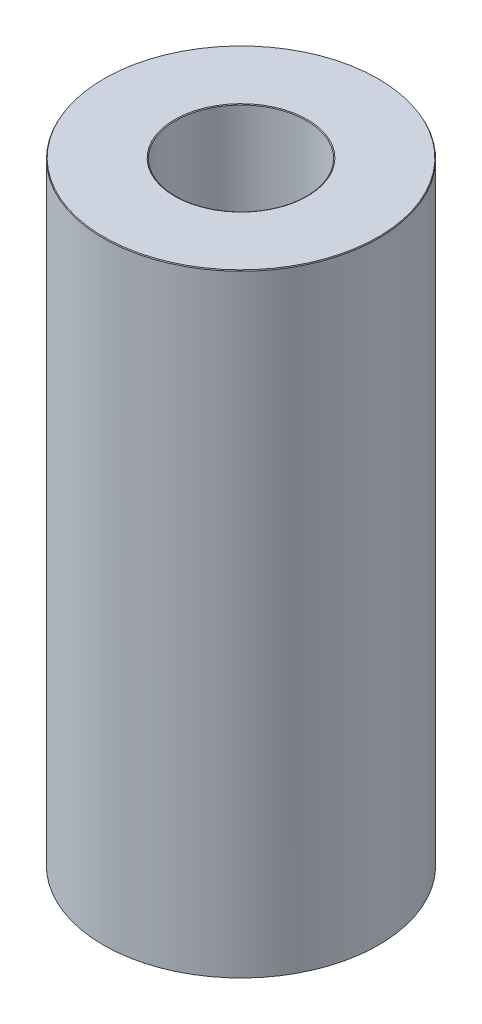
from build123d import *
from OCP.BRepFilletAPI import BRepFilletAPI_MakeChamfer

# Parameters (mm, degrees)
SKETCH1_R           = 37.5
BOSS_EXTRUDE1_DEPTH = 167.169219615
SKETCH2_R           = 17.860774592
CUT_EXTRUDE1_DEPTH  = 176.37972513
CHAMFER1_SIZE       = 0.236967705
CHAMFER1_SIZE2      = 0.136813369


with BuildPart() as part:
    # Sketch1 → Boss-Extrude1 (new body)
    with BuildSketch(Plane(origin=(0, 0, 0), x_dir=(1, 0, 0), z_dir=(0, 1, 0))):
        Circle(SKETCH1_R)
    extrude(amount=BOSS_EXTRUDE1_DEPTH)

    # Sketch2 → Cut-Extrude1 (cut, through all)
    with BuildSketch(Plane(origin=(0, 0, 0), x_dir=(1, 0, 0), z_dir=(0, 1, 0))):
        Circle(SKETCH2_R)
    extrude(amount=CUT_EXTRUDE1_DEPTH, mode=Mode.SUBTRACT)

    # Chamfer1: one chamfer whose edges measure the first distance from different faces: ONE call of the kernel's chamfer builder (chamfer() names one face for all edges)
    chamfer1_edges_1 = [part.edges().sort_by_distance(p)[0] for p in [
        (-17.860774592, 167.169219615, 0),
    ]]
    chamfer1_side_1 = [part.faces().sort_by_distance(p)[0] for p in [
        (-36.439339828, 167.169219615, 0),
    ]]
    chamfer1_edges_2 = [part.edges().sort_by_distance(p)[0] for p in [
        (-17.860774592, 0, 0),
    ]]
    chamfer1_side_2 = [part.faces().sort_by_distance(p)[0] for p in [
        (-17.860774592, 83.584609808, 0),
    ]]
    chamfer1_edges_3 = [part.edges().sort_by_distance(p)[0] for p in [
        (-37.5, 0, 0),
    ]]
    chamfer1_side_3 = [part.faces().sort_by_distance(p)[0] for p in [
        (-36.439339828, 0, 0),
    ]]
    chamfer1_edges_4 = [part.edges().sort_by_distance(p)[0] for p in [
        (-37.5, 167.169219615, 0),
    ]]
    chamfer1_side_4 = [part.faces().sort_by_distance(p)[0] for p in [
        (-37.5, 83.584609808, 0),
    ]]
    chamfer1 = BRepFilletAPI_MakeChamfer(part.part.solid().wrapped)
    for e in chamfer1_edges_1:
        chamfer1.Add(CHAMFER1_SIZE, CHAMFER1_SIZE2, e.wrapped, chamfer1_side_1[0].wrapped)  # the first distance lies on this face
    for e in chamfer1_edges_2:
        chamfer1.Add(CHAMFER1_SIZE, CHAMFER1_SIZE2, e.wrapped, chamfer1_side_2[0].wrapped)  # the first distance lies on this face
    for e in chamfer1_edges_3:
        chamfer1.Add(CHAMFER1_SIZE, CHAMFER1_SIZE2, e.wrapped, chamfer1_side_3[0].wrapped)  # the first distance lies on this face
    for e in chamfer1_edges_4:
        chamfer1.Add(CHAMFER1_SIZE, CHAMFER1_SIZE2, e.wrapped, chamfer1_side_4[0].wrapped)  # the first distance lies on this face
    add(Compound.cast(chamfer1.Shape()), mode=Mode.REPLACE)


solid = part.part
